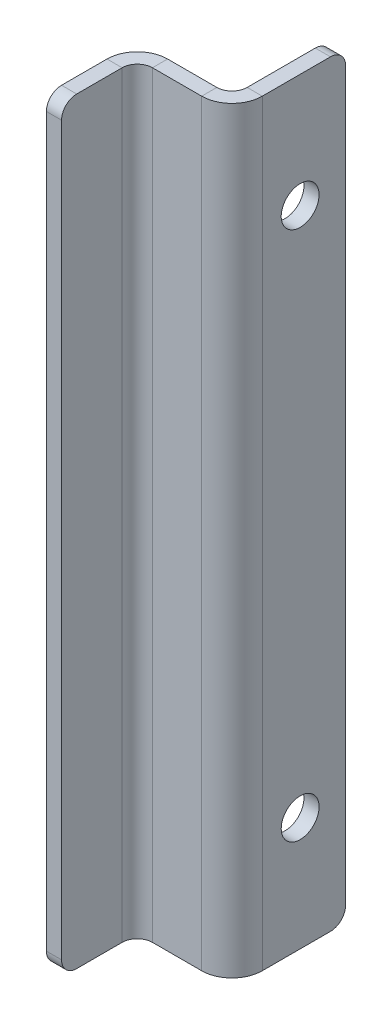
from build123d import *

# Parameters (mm, degrees)
BASE_FLANGE1_DEPTH = 50
SKETCH3_R          = 2.5
EXTRUDE1_DEPTH     = 2
FILLET1_R          = 2


# Sheet-metal steps are written as plain solids
with BuildPart() as part:
    # Sketch1 → Base-Flange1 (new, symmetric)
    with BuildSketch(Plane(origin=(0, 0, 0), x_dir=(-1, 0, 0), z_dir=(0, 1, 0))):
        with BuildLine():
            Line((0, 0), (0, -8))
            ThreePointArc((0, -8), (-0.585786438, -9.414213562), (-2, -10))
            Line((-2, -10), (-8.5, -10))
            ThreePointArc((-8.5, -10), (-11.328427125, -11.171572875), (-12.5, -14))
            Line((-12.5, -14), (-12.5, -25))
            Line((-12.5, -25), (-10.5, -25))
            Line((-10.5, -25), (-10.5, -14))
            ThreePointArc((-10.5, -14), (-9.914213562, -12.585786438), (-8.5, -12))
            Line((-8.5, -12), (-2, -12))
            ThreePointArc((-2, -12), (0.828427125, -10.828427125), (2, -8))
            Line((2, -8), (2, 0))
            Line((2, 0), (0, 0))
        make_face()
    extrude(amount=BASE_FLANGE1_DEPTH, both=True)

    # Sketch3 → Extrude1 (cut)
    with BuildSketch(Plane(origin=(12.5, 0, 0), x_dir=(0, 0, 1), z_dir=(1, 0, 0))):
        with Locations((-19, 35)):
            Circle(SKETCH3_R)
        with Locations(Location((-19, -35, 0), (0, 0, 180))):
            Circle(SKETCH3_R)
    extrude(amount=-EXTRUDE1_DEPTH, mode=Mode.SUBTRACT)

    # Fillet1
    fillet1_edges = [part.edges().sort_by_distance(p)[0] for p in [
        (-1, -50, 0),
        (11.5, -50, -25),
        (-1, 50, 0),
        (11.5, 50, -25),
    ]]
    fillet(fillet1_edges, radius=FILLET1_R)


solid = part.part
